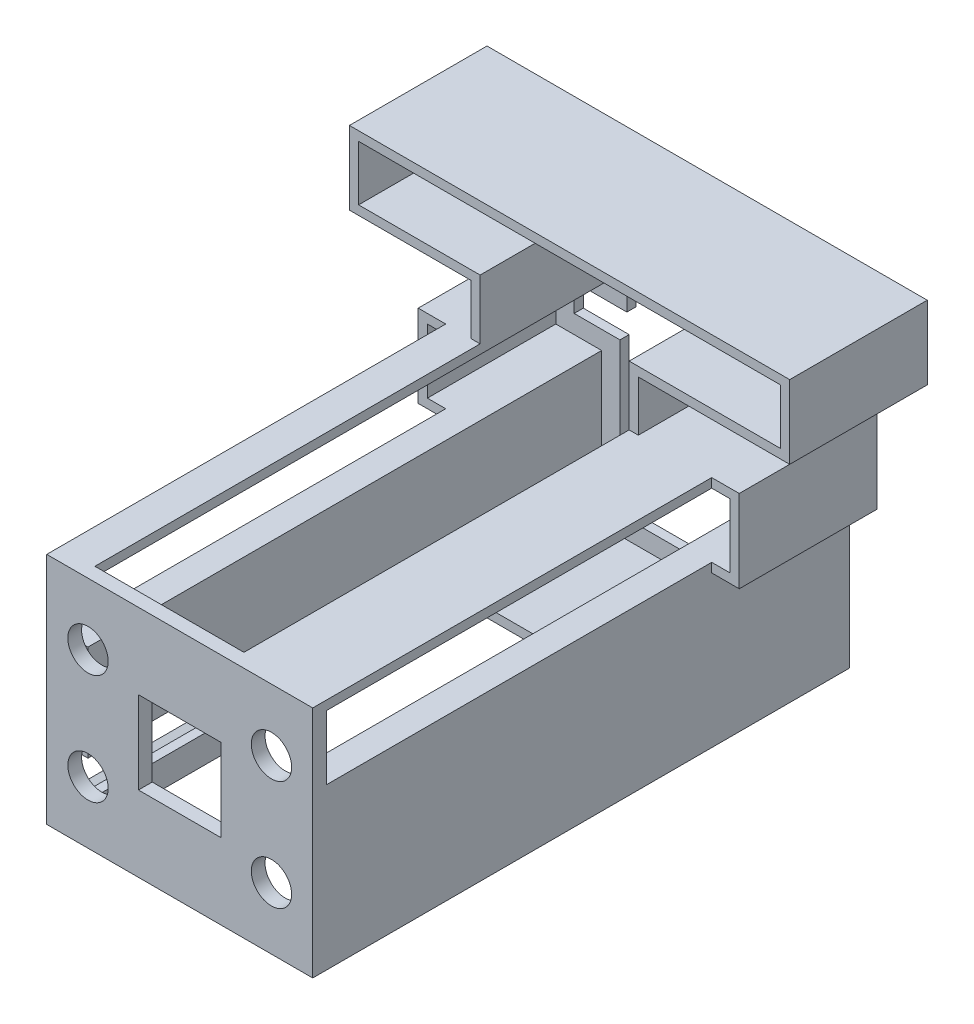
from build123d import *

# Parameters (mm, degrees)
EXTRUDE_1_DEPTH        = 15
CUT_EXTRUDE_1_DEPTH    = 14
SKETCH_7_W             = 46
SKETCH_7_H             = 6
CUT_EXTRUDE_2_DEPTH    = 1
SKETCH_8_W             = 14
SKETCH_8_H             = 4
CUT_EXTRUDE_3_DEPTH    = 1
CUT_EXTRUDE_6_DEPTH    = 1
EXTRUDE_START          = -57
EXTRUDE_10_OUTLINE_W   = 3
EXTRUDE_10_OUTLINE_H   = 17.5
EXTRUDE_10_OUTLINE_H_2 = 10.5
EXTRUDE_10_OUTLINE_W_2 = 9
EXTRUDE_10_OUTLINE_H_3 = 1
EXTRUDE_10_OUTLINE_W_3 = 2
EXTRUDE_10_DEPTH       = 57
SKETCH_29_W            = 29
SKETCH_29_H            = 25.5
EXTRUDE_12_DEPTH       = 1.5
SKETCH_30_R            = 2.2
SKETCH_30_W            = 9
SKETCH_30_H            = 9
CUT_EXTRUDE_8_DEPTH    = 1.5
SKETCH_31_W            = 1.75
SKETCH_31_H            = 1
EXTRUDE_13_DEPTH       = 42


# Read off the part's stored shape, not the designer's step: 凸台-拉伸10
with BuildPart() as part:
    # 草图3 → 凸台-拉伸1 (new body)
    with BuildSketch(Plane.XY):
        Polygon((-25, 21.5), (23, 21.5), (23, 13.5), (6.5, 13.5), (6.5, 8), (17.5, 8), (17.5, -1), (12.5, -1), (12.5, -17.5), (-12.5, -17.5), (-12.5, -1), (-17.5, -1), (-17.5, 8), (-11.75, 8), (-11.75, 13.5), (-25, 13.5), align=None)
    extrude(amount=EXTRUDE_1_DEPTH)

    # 草图4 → 切除-拉伸1 (cut)
    with BuildSketch(Plane.XY.offset(15)):
        Polygon((22, 20.5), (-24, 20.5), (-24, 14.5), (-10.75, 14.5), (-10.75, 7), (-16.5, 7), (-16.5, 0), (-11.5, 0), (-11.5, -16.5), (11.5, -16.5), (11.5, 0), (16.5, 0), (16.5, 7), (5.5, 7), (5.5, 14.5), (22, 14.5), align=None)
    extrude(amount=-CUT_EXTRUDE_1_DEPTH, mode=Mode.SUBTRACT)

    # 草图7 → 切除-拉伸2 (cut)
    with BuildSketch(Plane.XY.offset(1)):
        with Locations((-1, 17.5)):
            Rectangle(SKETCH_7_W, SKETCH_7_H)
    extrude(amount=-CUT_EXTRUDE_2_DEPTH, mode=Mode.SUBTRACT)

    # 草图8 → 切除-拉伸3 (cut)
    with BuildSketch(Plane.ZY.offset(12.5)):
        with Locations((8, -12.5)):
            Rectangle(SKETCH_8_W, SKETCH_8_H)
    extrude(amount=-CUT_EXTRUDE_3_DEPTH, mode=Mode.SUBTRACT)

    # 草图9 → 切除-拉伸6 (cut)
    with BuildSketch(Plane(origin=(0, 0, 0), x_dir=(-1, 0, 0), z_dir=(0, 0, -1))):
        Polygon((-3.5, 11.5), (-3.5, 5), (-14.5, 5), (-14.5, 2), (-9.5, 2), (-9.5, -14.5), (9.5, -14.5), (9.5, 2), (14.5, 2), (14.5, 5), (8.75, 5), (8.75, 11.5), align=None)
    extrude(amount=-CUT_EXTRUDE_6_DEPTH, mode=Mode.SUBTRACT)

    # 凸台-拉伸10 outline → 凸台-拉伸10 (add)
    with BuildSketch(Plane(origin=(0, 0, 0), x_dir=(-1, 0, 0), z_dir=(0, 0, -1)).offset(EXTRUDE_START)):
        with Locations((-13, -8.75)):
            Rectangle(EXTRUDE_10_OUTLINE_W, EXTRUDE_10_OUTLINE_H)
        Polygon((14.5, -15.5), (12.5, -14.5), (11.5, -14.5), (11.5, -17.5), (14.5, -17.5), align=None)
        with Locations((13, -5.25)):
            Rectangle(EXTRUDE_10_OUTLINE_W, EXTRUDE_10_OUTLINE_H_2)
        with Locations((-10, 7.5)):
            Rectangle(EXTRUDE_10_OUTLINE_W_2, EXTRUDE_10_OUTLINE_H_3)
        with Locations((13.5, 7.5)):
            Rectangle(EXTRUDE_10_OUTLINE_W_3, EXTRUDE_10_OUTLINE_H_3)
    extrude(amount=EXTRUDE_10_DEPTH)

    # 草图29 → 凸台-拉伸12 (add)
    with BuildSketch(Plane.XY.offset(57)):
        with Locations((0, -4.75)):
            Rectangle(SKETCH_29_W, SKETCH_29_H)
    extrude(amount=EXTRUDE_12_DEPTH)

    # 草图30 → 切除-拉伸8 (cut)
    with BuildSketch(Plane.XY.offset(58.5)):
        with Locations((-10, 1.25)):
            Circle(SKETCH_30_R)
        with Locations((-10, -10.75)):
            Circle(SKETCH_30_R)
        with Locations((10, 1.25)):
            Circle(SKETCH_30_R)
        with Locations((10, -10.75)):
            Circle(SKETCH_30_R)
        with Locations((0, -4.75)):
            Rectangle(SKETCH_30_W, SKETCH_30_H)
    extrude(amount=-CUT_EXTRUDE_8_DEPTH, mode=Mode.SUBTRACT)

    # 草图31 → 凸台-拉伸13 (add)
    with BuildSketch(Plane.XY.offset(15)):
        with Locations((-11.625, 7.5)):
            Rectangle(SKETCH_31_W, SKETCH_31_H)
    extrude(amount=EXTRUDE_13_DEPTH)


solid = part.part
